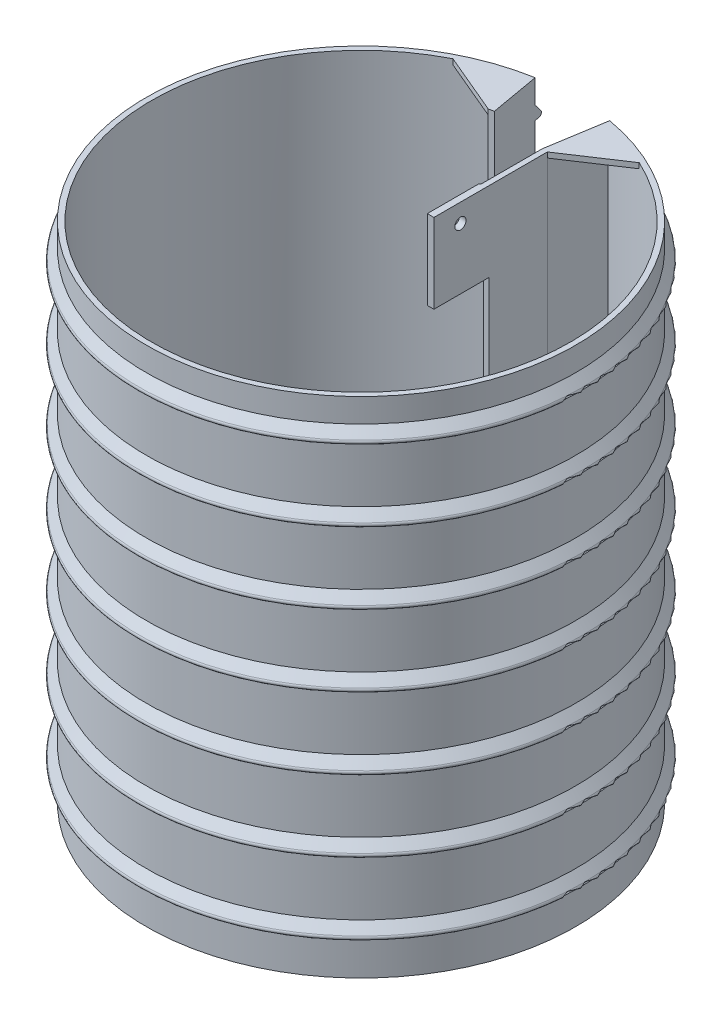
from build123d import *

# Parameters (mm, degrees)
RESSALTO_EXTRUS_O1_DEPTH = 190
PADR_O_LINEAR1_COUNT     = 7
PADR_O_LINEAR1_PITCH     = 27
RESSALTO_EXTRUS_O2_DEPTH = 30
CORTE_EXTRUS_O1_REACH    = 230.996
ESBO_O5_R                = 2.1
RESSALTO_EXTRUS_O3_START = -165
RESSALTO_EXTRUS_O3_DEPTH = 165
RESSALTO_EXTRUS_O4_START = -2
RESSALTO_EXTRUS_O4_DEPTH = 2


with BuildPart() as part:
    # Esboço1 → Ressalto-extrusão1 (new body)
    with BuildSketch(Plane(origin=(0, 0, 0), x_dir=(1, 0, 0), z_dir=(0, 1, 0))):
        with BuildLine():
            Line((-13.718206036, 77.799812488), (-14.065502391, 79.769427994))
            ThreePointArc((-14.065502391, 79.769427994), (0, -81), (14.065502391, 79.769427994))
            Line((14.065502391, 79.769427994), (13.718206036, 77.799812488))
            Line((13.718206036, 77.799812488), (10.5, 57.8))
            Line((10.5, 57.8), (10.5, 35.8))
            Line((10.5, 35.8), (12.5, 35.8))
            Line((12.5, 35.8), (12.5, 57.8))
            Line((12.5, 57.8), (15.659101617, 77.432503101))
            ThreePointArc((15.659101617, 77.432503101), (-0.987673003, -78.993825721), (-13.718206036, 77.799812488))
        make_face()
    extrude(amount=RESSALTO_EXTRUS_O1_DEPTH)

    # Varredura1: sweep along a path in Esboço3
    with BuildLine(Plane(origin=(0, 13, 0), x_dir=(1, 0, 0), z_dir=(0, 1, 0))) as varredura1_path:
        ThreePointArc((-14.15232648, 80.26183187), (0, -81.5), (14.15232648, 80.26183187))
    # Esboço2 → Varredura1 (sweep)
    with BuildSketch(Plane(origin=(0, 0, 0), x_dir=(-0.1736481776669239, 0, -0.9848077530122092), z_dir=(0.9848077530122091, 0, -0.17364817766692386))):
        with BuildLine():
            Line((81, 14), (82.919375153, 14))
            ThreePointArc((82.919375153, 14), (83.820678389, 14.56681127), (83.700243962, 15.624695048))
            Line((83.700243962, 15.624695048), (81, 19))
            Line((81, 19), (81, 14))
        make_face()
    varredura1 = sweep(path=varredura1_path.line)

    # Padrão linear1: Varredura1 ×7
    with Locations(*[(0, i * PADR_O_LINEAR1_PITCH, 0) for i in range(1, PADR_O_LINEAR1_COUNT)]):
        add(varredura1)

    # Esboço4 → Ressalto-extrusão2 (add)
    with BuildSketch(Plane(origin=(0, 190, 0), x_dir=(1, 0, 0), z_dir=(0, 1, 0))):
        Polygon((10.5, 35.8), (10.5, 35), (10, 34.5), (10, 15), (12.5, 15), (12.5, 35.8), align=None)
    extrude(amount=-RESSALTO_EXTRUS_O2_DEPTH)

    # Esboço5 → Corte-extrusão1 (cut, up to next)
    with BuildSketch(Plane(origin=(12.5, 0, 0), x_dir=(0, 0, -1), z_dir=(1, 0, 0)), mode=Mode.PRIVATE) as corte_extrus_o1_sk1:
        with Locations((25, 183)):
            Circle(ESBO_O5_R)
    corte_extrus_o1_tool1 = extrude(corte_extrus_o1_sk1.sketch, amount=-CORTE_EXTRUS_O1_REACH, mode=Mode.PRIVATE) & part.part
    add(corte_extrus_o1_tool1.solids().sort_by_distance((12.5, 183, -25))[0], mode=Mode.SUBTRACT)

    # Esboço6 → Ressalto-extrusão3 (add)
    with BuildSketch(Plane(origin=(0, 190, 0), x_dir=(1, 0, 0), z_dir=(0, 1, 0)).offset(RESSALTO_EXTRUS_O3_START)):
        with BuildLine():
            Line((-13.718206036, 77.799812488), (-10.766187015, 61.058080687))
            Line((-10.766187015, 61.058080687), (-12.735802521, 60.710784331))
            Line((-12.735802521, 60.710784331), (-16.219440766, 77.317072767))
            ThreePointArc((-16.219440766, 77.317072767), (-14.970769299, 77.568524974), (-13.718206036, 77.799812488))
        make_face()
    extrude(amount=RESSALTO_EXTRUS_O3_DEPTH)

    # Esboço7 → Ressalto-extrusão4 (add)
    with BuildSketch(Plane(origin=(0, 190, 0), x_dir=(1, 0, 0), z_dir=(0, 1, 0)).offset(RESSALTO_EXTRUS_O4_START)):
        with BuildLine():
            Line((-35.764684752, 70.440665276), (-12.735802521, 60.710784331))
            Line((-12.735802521, 60.710784331), (-16.219440766, 77.317072767))
            ThreePointArc((-16.219440766, 77.317072767), (-26.218477672, 74.522422321), (-35.764684752, 70.440665276))
        make_face()
        with BuildLine():
            Line((12.5, 57.8), (33.329519809, 71.625017342))
            ThreePointArc((33.329519809, 71.625017342), (24.665826157, 75.050629711), (15.659101617, 77.432503101))
            Line((15.659101617, 77.432503101), (12.5, 57.8))
        make_face()
    extrude(amount=RESSALTO_EXTRUS_O4_DEPTH)


solid = part.part
